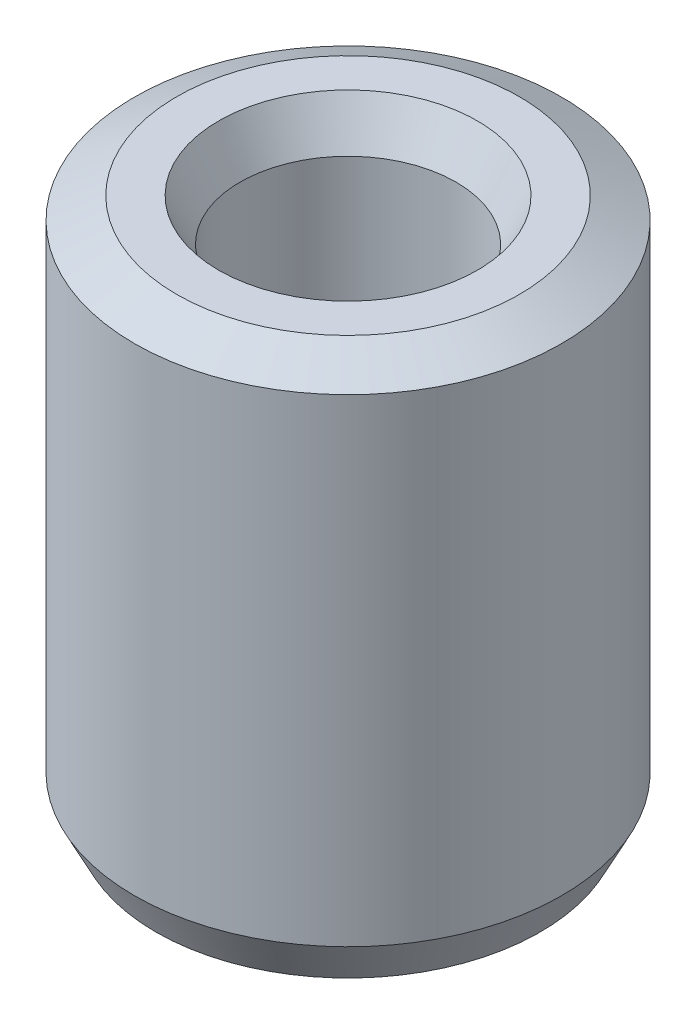
from build123d import *
from OCP.BRepFilletAPI import BRepFilletAPI_MakeChamfer

# Parameters (mm, degrees)
SKETCH1_R           = 15
BOSS_EXTRUDE1_DEPTH = 38.052163871
SKETCH2_R           = 7.579549142
CUT_EXTRUDE1_DEPTH  = 44.565665096
CHAMFER1_SIZE       = 1.506354487
CHAMFER1_SIZE2      = 2.967902707


with BuildPart() as part:
    # Sketch1 → Boss-Extrude1 (new body)
    with BuildSketch(Plane(origin=(0, 0, 0), x_dir=(1, 0, 0), z_dir=(0, 1, 0))):
        Circle(SKETCH1_R)
    extrude(amount=BOSS_EXTRUDE1_DEPTH)

    # Sketch2 → Cut-Extrude1 (cut, through all)
    with BuildSketch(Plane(origin=(0, 0, 0), x_dir=(1, 0, 0), z_dir=(0, 1, 0))):
        Circle(SKETCH2_R)
    extrude(amount=CUT_EXTRUDE1_DEPTH, mode=Mode.SUBTRACT)

    # Chamfer1: one chamfer whose edges measure the first distance from different faces: ONE call of the kernel's chamfer builder (chamfer() names one face for all edges)
    chamfer1_edges_1 = [part.edges().sort_by_distance(p)[0] for p in [
        (-7.579549142, 38.052163871, 0),
    ]]
    chamfer1_side_1 = [part.faces().sort_by_distance(p)[0] for p in [
        (-14.575735931, 38.052163871, 0),
    ]]
    chamfer1_edges_2 = [part.edges().sort_by_distance(p)[0] for p in [
        (-7.579549142, 0, 0),
    ]]
    chamfer1_side_2 = [part.faces().sort_by_distance(p)[0] for p in [
        (-7.579549142, 19.026081936, 0),
    ]]
    chamfer1_edges_3 = [part.edges().sort_by_distance(p)[0] for p in [
        (-15, 0, 0),
    ]]
    chamfer1_side_3 = [part.faces().sort_by_distance(p)[0] for p in [
        (-14.575735931, 0, 0),
    ]]
    chamfer1_edges_4 = [part.edges().sort_by_distance(p)[0] for p in [
        (-15, 38.052163871, 0),
    ]]
    chamfer1_side_4 = [part.faces().sort_by_distance(p)[0] for p in [
        (-15, 19.026081936, 0),
    ]]
    chamfer1 = BRepFilletAPI_MakeChamfer(part.part.solid().wrapped)
    for e in chamfer1_edges_1:
        chamfer1.Add(CHAMFER1_SIZE, CHAMFER1_SIZE2, e.wrapped, chamfer1_side_1[0].wrapped)  # the first distance lies on this face
    for e in chamfer1_edges_2:
        chamfer1.Add(CHAMFER1_SIZE, CHAMFER1_SIZE2, e.wrapped, chamfer1_side_2[0].wrapped)  # the first distance lies on this face
    for e in chamfer1_edges_3:
        chamfer1.Add(CHAMFER1_SIZE, CHAMFER1_SIZE2, e.wrapped, chamfer1_side_3[0].wrapped)  # the first distance lies on this face
    for e in chamfer1_edges_4:
        chamfer1.Add(CHAMFER1_SIZE, CHAMFER1_SIZE2, e.wrapped, chamfer1_side_4[0].wrapped)  # the first distance lies on this face
    add(Compound.cast(chamfer1.Shape()), mode=Mode.REPLACE)


solid = part.part
